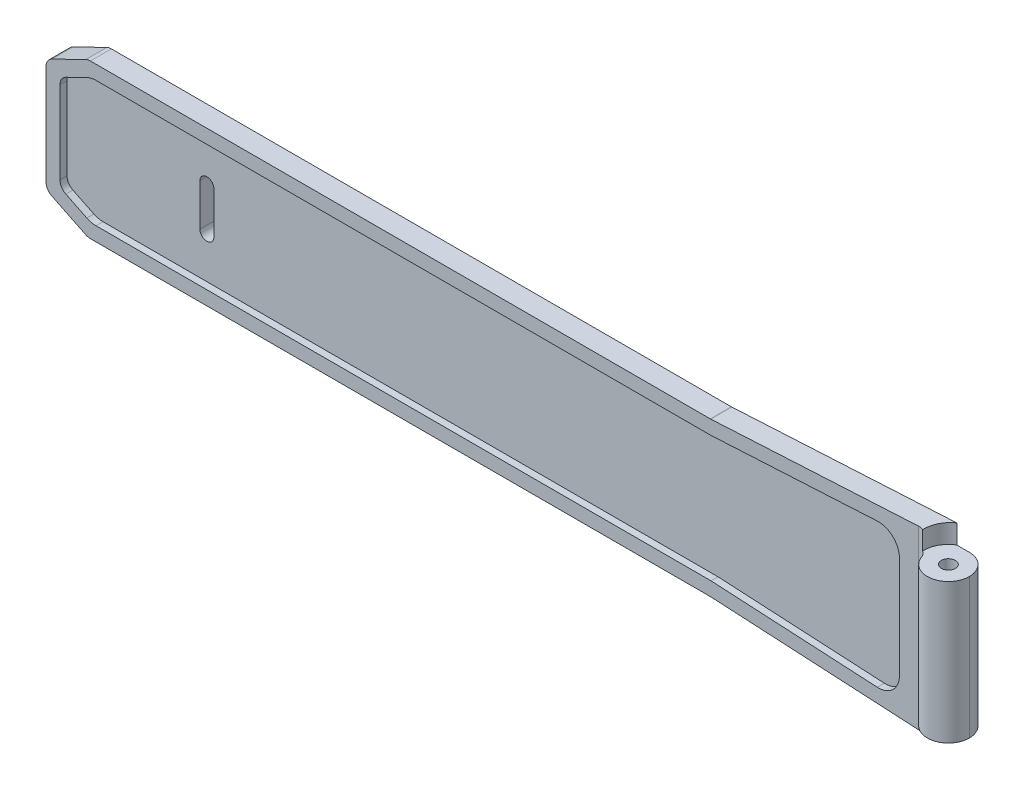
from build123d import *
from OCP.BRepFilletAPI import BRepFilletAPI_MakeChamfer, BRepFilletAPI_MakeFillet

# Parameters (mm, degrees)
SALIENTE_EXTRUIR1_DEPTH = 3
CHAFL_N1_SIZE           = 6
CHAFL_N1_SIZE2          = 2.926395531
CORTAR_EXTRUIR1_DEPTH   = 1
CROQUIS8_R              = 3
SALIENTE_EXTRUIR2_DEPTH = 12.5
REDONDEO1_R             = 3
CROQUIS9_R              = 3.5
CORTAR_EXTRUIR3_DEPTH   = 3
REDONDEO2_R             = 1.5
CROQUIS10_R             = 1
CORTAR_EXTRUIR4_DEPTH   = 15
CORTAR_EXTRUIR5_DEPTH   = 96.933922834
REDONDEO3_R1            = 3
REDONDEO3_R2            = 1.5
REDONDEO4_R             = 1.5


with BuildPart() as part:
    # Croquis1 → Saliente-Extruir1 (new body)
    with BuildSketch(Plane.XY):
        Polygon((0, 11), (-95, 11), (-95, -11), (0, -11), (37, -13), (37, 13), align=None)
    extrude(amount=SALIENTE_EXTRUIR1_DEPTH)

    # Chaflán1: one chamfer whose edges measure the first distance from different faces: ONE call of the kernel's chamfer builder (chamfer() names one face for all edges)
    chafl_n1_edges_1 = [part.edges().sort_by_distance(p)[0] for p in [
        (-95, 11, 1.5),
    ]]
    chafl_n1_side_1 = [part.faces().sort_by_distance(p)[0] for p in [
        (-47.5, 11, 1.5),
    ]]
    chafl_n1_edges_2 = [part.edges().sort_by_distance(p)[0] for p in [
        (-95, -11, 1.5),
    ]]
    chafl_n1_side_2 = [part.faces().sort_by_distance(p)[0] for p in [
        (-47.5, -11, 1.5),
    ]]
    chafl_n1 = BRepFilletAPI_MakeChamfer(part.part.solid().wrapped)
    for e in chafl_n1_edges_1:
        chafl_n1.Add(CHAFL_N1_SIZE, CHAFL_N1_SIZE2, e.wrapped, chafl_n1_side_1[0].wrapped)  # the first distance lies on this face
    for e in chafl_n1_edges_2:
        chafl_n1.Add(CHAFL_N1_SIZE, CHAFL_N1_SIZE2, e.wrapped, chafl_n1_side_2[0].wrapped)  # the first distance lies on this face
    add(Compound.cast(chafl_n1.Shape()), mode=Mode.REPLACE)

    # Croquis7 → Cortar-Extruir1 (cut)
    with BuildSketch(Plane.XY.offset(3)):
        Polygon((-88.538263618, 9), (-93, 6.823865765), (-93, 0), (27, 0), (27, 10.45653975), (0.054014627, 9), align=None)
        Polygon((27, 0), (-93, 0), (-93, -6.823865765), (-88.538263618, -9), (0.054014627, -9), (27, -10.45653975), align=None)
    extrude(amount=-CORTAR_EXTRUIR1_DEPTH, mode=Mode.SUBTRACT)

    # Croquis8 → Saliente-Extruir2 (add, symmetric)
    with BuildSketch(Plane(origin=(0, 0, 0), x_dir=(1, 0, 0), z_dir=(0, 1, 0))):
        with Locations((34, -3)):
            Circle(CROQUIS8_R)
    extrude(amount=SALIENTE_EXTRUIR2_DEPTH, both=True)

    # Redondeo1
    redondeo1_edges = [part.edges().sort_by_distance(p)[0] for p in [
        (37, 0, 0),
    ]]
    fillet(redondeo1_edges, radius=REDONDEO1_R - 0.0001)  # a hair under: the kernel refuses the full size

    # Croquis9 → Cortar-Extruir3 (cut)
    with BuildSketch(Plane(origin=(0, -13, 0), x_dir=(1, 0, 0), z_dir=(0, 1, 0))):
        with Locations((34, -3)):
            Circle(CROQUIS9_R)
    cortar_extruir3 = extrude(amount=CORTAR_EXTRUIR3_DEPTH, mode=Mode.SUBTRACT)

    # Simetría1: Cortar-Extruir3 across plane
    add(cortar_extruir3.mirror(Plane.ZX), mode=Mode.SUBTRACT)

    # Redondeo2
    redondeo2_edges = [part.edges().sort_by_distance(p)[0] for p in [
        (31, 0, 3),
    ]]
    fillet(redondeo2_edges, radius=REDONDEO2_R)

    # Croquis10 → Cortar-Extruir4 (cut, symmetric)
    with BuildSketch(Plane(origin=(0, 0, 0), x_dir=(1, 0, 0), z_dir=(0, 1, 0))):
        with Locations(Location((34, -3, 0), (0, 0, 270))):
            Circle(CROQUIS10_R)
    extrude(amount=CORTAR_EXTRUIR4_DEPTH, both=True, mode=Mode.SUBTRACT)

    # Croquis11 → Cortar-Extruir5 (cut, through all)
    with BuildSketch(Plane.XY.offset(2)):
        with BuildLine():
            Line((-74, -3), (-74, 3))
            ThreePointArc((-74, 3), (-73, 4), (-72, 3))
            Line((-72, 3), (-72, -3))
            ThreePointArc((-72, -3), (-73, -4), (-74, -3))
        make_face()
    extrude(amount=-CORTAR_EXTRUIR5_DEPTH, mode=Mode.SUBTRACT)

    # Redondeo3: one fillet with a radius per group of edges: ONE call of the kernel's fillet builder (fillet() takes one radius for all edges)
    redondeo3_edges_1 = [part.edges().sort_by_distance(p)[0] for p in [
        (27, 10.45653975, 2.5),
        (27, -10.45653975, 2.5),
        (-88.538263618, 9, 2.5),
        (-88.538263618, -9, 2.5),
    ]]
    redondeo3_edges_2 = [part.edges().sort_by_distance(p)[0] for p in [
        (-93, 6.823865765, 2.5),
        (-93, -6.823865765, 2.5),
    ]]
    redondeo3 = BRepFilletAPI_MakeFillet(part.part.solid().wrapped)
    for e in redondeo3_edges_1:
        redondeo3.Add(REDONDEO3_R1, e.wrapped)
    for e in redondeo3_edges_2:
        redondeo3.Add(REDONDEO3_R2, e.wrapped)
    add(Compound.cast(redondeo3.Shape()), mode=Mode.REPLACE)

    # Redondeo4
    redondeo4_edges = [part.edges().sort_by_distance(p)[0] for p in [
        (0, 11, 1.5),
        (0, -11, 1.5),
        (-89, -11, 1.5),
        (-95, 8.073604469, 1.5),
        (-95, -8.073604469, 1.5),
        (-89, 11, 1.5),
    ]]
    fillet(redondeo4_edges, radius=REDONDEO4_R)


solid = part.part
